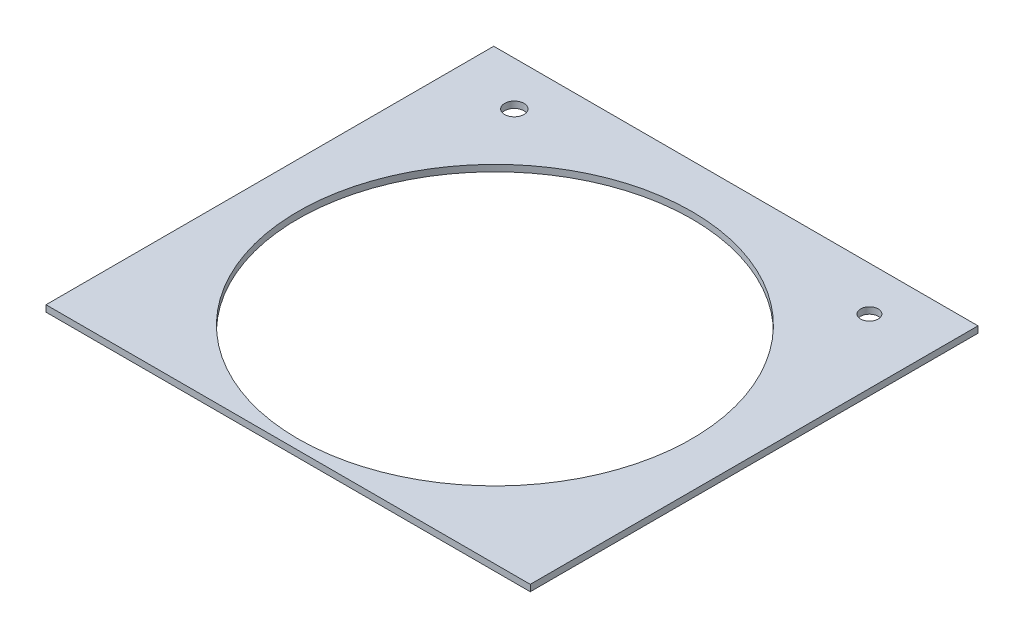
from build123d import *

# Parameters (mm, degrees)
SKETCH1_W           = 75
SKETCH1_H           = 69.344557783
SKETCH1_R           = 1.5
SKETCH1_R_2         = 1.363636364
SKETCH1_R_3         = 30.5
BOSS_EXTRUDE1_DEPTH = 1


with BuildPart() as part:
    # Sketch1 → Boss-Extrude1 (new body)
    with BuildSketch(Plane(origin=(0, 0, 0), x_dir=(1, 0, 0), z_dir=(0, 1, 0))):
        with Locations((0, 0.162321047)):
            Rectangle(SKETCH1_W, SKETCH1_H)
        with Locations((-27.5, 28.016418119)):
            Circle(SKETCH1_R, mode=Mode.SUBTRACT)
        with Locations((27.5, 28.016418119)):
            Circle(SKETCH1_R_2, mode=Mode.SUBTRACT)
        with Locations((0, -2.483581881)):
            Circle(SKETCH1_R_3, mode=Mode.SUBTRACT)
    extrude(amount=BOSS_EXTRUDE1_DEPTH)


solid = part.part
